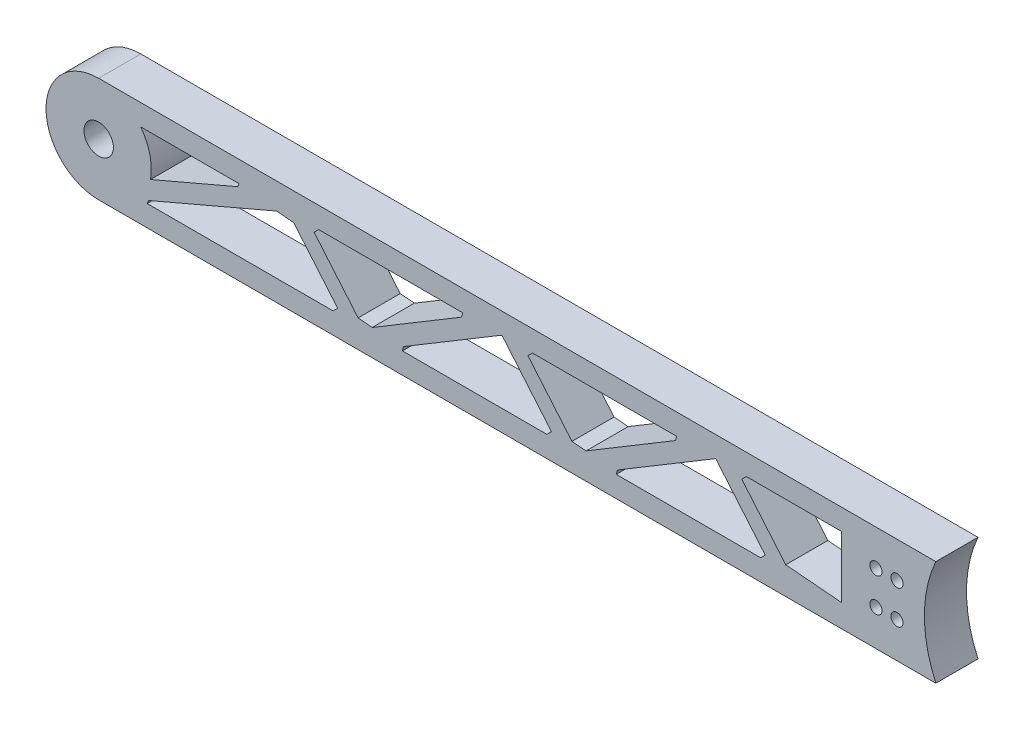
from build123d import *

# Parameters (mm, degrees)
EXTRUDE_1_DEPTH          = 10
CUT_EXTRUDE_1_DEPTH      = 252.652538235
CUT_EXTRUDE_1_DEPTH_BACK = 252.652538235
SKETCH_7_R               = 3.5
CUT_EXTRUDE_5_DEPTH      = 252.652538235
SKETCH_8_R               = 5
CUT_EXTRUDE_6_DEPTH      = 3
SKETCH_9_R               = 3
CUT_EXTRUDE_7_DEPTH      = 252.652538235
CUT_EXTRUDE_START        = -10
SKETCH_11_R              = 27
CUT_EXTRUDE_9_DEPTH      = 10
SKETCH_12_R              = 30
CUT_EXTRUDE_10_DEPTH     = 10
SKETCH_14_R              = 1.45
CUT_EXTRUDE_12_DEPTH     = 300
CHAMFER_1_SIZE           = 16.633608268
CHAMFER_1_SIZE_2         = 2
CHAMFER_1_SIZE_3         = 1.419352868
CHAMFER_1_SIZE_4         = 1.457737974
CHAMFER_1_SIZE_5         = 2.415237377
CHAMFER_1_SIZE_6         = 1.523154621
CHAMFER_1_SIZE_7         = 3.004873211
SKETCH_15_R              = 5.25
SKETCH_15_R_2            = 3.5
CUT_EXTRUDE_13_DEPTH     = 3


with BuildPart() as part:
    # 草图1 → 凸台-拉伸1 (new body)
    with BuildSketch(Plane.XY):
        with BuildLine():
            Line((0, 12.5), (199.067804112, 12.5))
            ThreePointArc((199.067804112, 12.5), (250, 0), (199.067804112, -12.5))
            Line((199.067804112, -12.5), (0, -12.5))
            ThreePointArc((0, -12.5), (-12.5, 0), (0, 12.5))
        make_face()
    extrude(amount=EXTRUDE_1_DEPTH)

    # 草图3 → 切除-拉伸1 (cut, two sides: drawn at the far end of the back side and taken through both)
    with BuildSketch(Plane.XY.offset(10).offset(-CUT_EXTRUDE_1_DEPTH_BACK)):
        Polygon((176.376805713, 7.5), (151.73545401, 7.5), (164.376805713, -7.5), (176.376805713, -7.5), align=None)
        Polygon((159.145761472, -7.5), (146.504409769, 7.5), (146.399203355, 7.5), (121.399203355, -7.5), align=None)
        Polygon((113.624600829, -7.5), (138.624600829, 7.5), (100.983249125, 7.5), align=None)
        Polygon((70.646998471, -7.5), (108.393556588, -7.5), (95.752204884, 7.5), (95.646998471, 7.5), align=None)
        Polygon((50.231044241, 7.5), (62.872395944, -7.5), (87.872395944, 7.5), align=None)
        Polygon((10, -7.5), (57.641351703, -7.5), (45, 7.5), align=None)
        with BuildLine():
            Line((34.845635859, 7.5), (10, 7.5))
            ThreePointArc((10, 7.5), (12.156331085, 2.910947362), (12.312475569, -2.157068696))
            Line((12.312475569, -2.157068696), (34.845635859, 7.5))
        make_face()
    extrude(amount=CUT_EXTRUDE_1_DEPTH + CUT_EXTRUDE_1_DEPTH_BACK, mode=Mode.SUBTRACT)

    # 草图7 → 切除-拉伸5 (cut, through all)
    with BuildSketch(Plane(origin=(0, 0, 0), x_dir=(-1, 0, 0), z_dir=(0, 0, -1))):
        Circle(SKETCH_7_R)
    extrude(amount=-CUT_EXTRUDE_5_DEPTH, mode=Mode.SUBTRACT)

    # 草图8 → 切除-拉伸6 (cut)
    with BuildSketch(Plane(origin=(0, 0, 0), x_dir=(-1, 0, 0), z_dir=(0, 0, -1))):
        with Locations((-223, 0)):
            Circle(SKETCH_8_R)
    extrude(amount=-CUT_EXTRUDE_6_DEPTH, mode=Mode.SUBTRACT)

    # 草图9 → 切除-拉伸7 (cut, through all)
    with BuildSketch(Plane(origin=(0, 0, 0), x_dir=(-1, 0, 0), z_dir=(0, 0, -1))):
        with Locations((-223, 0)):
            Circle(SKETCH_9_R)
    extrude(amount=-CUT_EXTRUDE_7_DEPTH, mode=Mode.SUBTRACT)

    # 草图11 → 切除-拉伸9 (cut)
    with BuildSketch(Plane.XY.offset(10).offset(CUT_EXTRUDE_START)):
        with Locations((223, 0)):
            Circle(SKETCH_11_R)
    extrude(amount=CUT_EXTRUDE_9_DEPTH, mode=Mode.SUBTRACT)

    # 草图12 → 切除-拉伸10 (cut)
    with BuildSketch(Plane.XY.offset(10)):
        with Locations((226, 0)):
            Circle(SKETCH_12_R)
    extrude(amount=-CUT_EXTRUDE_10_DEPTH, mode=Mode.SUBTRACT)

    # 草图14 → 切除-拉伸12 (cut)
    with BuildSketch(Plane.XY.offset(10)):
        with Locations((184.5, 4)):
            Circle(SKETCH_14_R)
        with Locations((189.5, 4)):
            Circle(SKETCH_14_R)
        with Locations((189.5, -4)):
            Circle(SKETCH_14_R)
        with Locations((184.5, -4)):
            Circle(SKETCH_14_R)
    extrude(amount=-CUT_EXTRUDE_12_DEPTH, mode=Mode.SUBTRACT)

    # 倒角1
    # the kernel refuses this chamfer: 16.633608268, 3.004873211, 2.415237377, 2, 1.523154621, 1.457737974, 1.419352868 mm, written as the material it adds along each edge
    with BuildSketch(Plane(origin=(164.376805713, -7.5, 0), x_dir=(0.9999946519205123, -0.0032704939035876055, 0), z_dir=(0, 0, 1))) as chamfer_1_piece_1:
        Polygon((CHAMFER_1_SIZE * 0.999994651904, CHAMFER_1_SIZE * 0.00327049390353), (-CHAMFER_1_SIZE_2 * 0.646924574173, CHAMFER_1_SIZE_2 * 0.762553995026), (0, 0), align=None)
    extrude(amount=10)
    with BuildSketch(Plane(origin=(151.73545401, 7.5, 0), x_dir=(0.9996219169112968, 0.027495876610586605, 0), z_dir=(0, 0, 1))) as chamfer_1_piece_2:
        Polygon((CHAMFER_1_SIZE_2 * 0.999621916911, -CHAMFER_1_SIZE_2 * 0.0274958766106), (CHAMFER_1_SIZE_3 * 0.623158385834, -CHAMFER_1_SIZE_3 * 0.782095662754), (0, 0), align=None)
    extrude(amount=10)
    with BuildSketch(Plane(origin=(159.145761472, -7.5, 10), x_dir=(-0.9996219169112968, -0.02749587661058747, 0), z_dir=(0, 0, -1))) as chamfer_1_piece_3:
        Polygon((CHAMFER_1_SIZE_2 * 0.999621916911, CHAMFER_1_SIZE_2 * 0.0274958766106), (CHAMFER_1_SIZE_3 * 0.623158385834, CHAMFER_1_SIZE_3 * 0.782095662754), (0, 0), align=None)
    extrude(amount=10)
    with BuildSketch(Plane(origin=(121.399203355, -7.5, 10), x_dir=(0.9985473741645164, -0.05388080872768336, 0), z_dir=(0, 0, -1))) as chamfer_1_piece_4:
        Polygon((CHAMFER_1_SIZE_4 * 0.998547373967, -CHAMFER_1_SIZE_4 * 0.053880808717), (CHAMFER_1_SIZE_2 * 0.828525861946, -CHAMFER_1_SIZE_2 * 0.559950797917), (0, 0), align=None)
    extrude(amount=10)
    with BuildSketch(Plane(origin=(113.624600829, -7.5, 10), x_dir=(-0.6693179531686358, 0.7429760948820275, 0), z_dir=(0, 0, -1))) as chamfer_1_piece_5:
        Polygon((CHAMFER_1_SIZE_2 * 0.999455005814, CHAMFER_1_SIZE_2 * 0.033010473375), (-CHAMFER_1_SIZE_5 * 0.191677362679, CHAMFER_1_SIZE_5 * 0.981457991195), (0, 0), align=None)
    extrude(amount=10)
    with BuildSketch(Plane(origin=(138.624600829, 7.5, 0), x_dir=(-0.9985473741645164, 0.05388080872768389, 0), z_dir=(0, 0, 1))) as chamfer_1_piece_6:
        Polygon((CHAMFER_1_SIZE_4 * 0.998547373967, CHAMFER_1_SIZE_4 * 0.053880808717), (CHAMFER_1_SIZE_2 * 0.828525861946, CHAMFER_1_SIZE_2 * 0.559950797917), (0, 0), align=None)
    extrude(amount=10)
    with BuildSketch(Plane(origin=(100.983249125, 7.5, 10), x_dir=(0.6007510451121151, -0.7994361649291964, 0), z_dir=(0, 0, -1))) as chamfer_1_piece_7:
        Polygon((CHAMFER_1_SIZE_3 * 0.998441703797, -CHAMFER_1_SIZE_3 * 0.0558046920381), (CHAMFER_1_SIZE_2 * 0.600751045112, -CHAMFER_1_SIZE_2 * 0.799436164929), (0, 0), align=None)
    extrude(amount=10)
    with BuildSketch(Plane(origin=(70.646998471, -7.5, 0), x_dir=(0.8430222103307435, 0.537878752963033, 0), z_dir=(0, 0, 1))) as chamfer_1_piece_8:
        Polygon((CHAMFER_1_SIZE_2 * 0.999621916911, -CHAMFER_1_SIZE_2 * 0.0274958766106), (CHAMFER_1_SIZE_4 * 0.843022210164, -CHAMFER_1_SIZE_4 * 0.537878752857), (0, 0), align=None)
    extrude(amount=10)
    with BuildSketch(Plane(origin=(108.393556588, -7.5, 0), x_dir=(-0.6007510451121131, 0.799436164929198, 0), z_dir=(0, 0, 1)), Plane(origin=(50.231044241, 7.5, 0), x_dir=(0.6007510451121165, -0.7994361649291954, 0), z_dir=(0, 0, 1)), Plane(origin=(57.641351703, -7.5, 0), x_dir=(-0.6007510451121163, 0.7994361649291957, 0), z_dir=(0, 0, 1))) as chamfer_1_piece_9:
        Polygon((CHAMFER_1_SIZE_3 * 0.998441703797, CHAMFER_1_SIZE_3 * 0.0558046920381), (CHAMFER_1_SIZE_2 * 0.600751045112, CHAMFER_1_SIZE_2 * 0.799436164929), (0, 0), align=None)
    extrude(amount=10)
    with BuildSketch(Plane(origin=(87.872395944, 7.5, 10), x_dir=(-0.8430222103307434, -0.5378787529630333, 0), z_dir=(0, 0, -1))) as chamfer_1_piece_10:
        Polygon((CHAMFER_1_SIZE_2 * 0.999621916911, CHAMFER_1_SIZE_2 * 0.0274958766106), (CHAMFER_1_SIZE_4 * 0.843022210164, CHAMFER_1_SIZE_4 * 0.537878752857), (0, 0), align=None)
    extrude(amount=10)
    with BuildSketch(Plane(origin=(62.872395944, -7.5, 10), x_dir=(0.8689411613860879, 0.4949154049420938, 0), z_dir=(0, 0, -1))) as chamfer_1_piece_11:
        Polygon((CHAMFER_1_SIZE_5 * 0.99974277381, -CHAMFER_1_SIZE_5 * 0.0226800806836), (-CHAMFER_1_SIZE_2 * 0.18152448307, -CHAMFER_1_SIZE_2 * 0.983386425596), (0, 0), align=None)
    extrude(amount=10)
    with BuildSketch(Plane(origin=(10, -7.5, 10), x_dir=(0.9079663603978809, 0.419043062686671, 0), z_dir=(0, 0, -1))) as chamfer_1_piece_12:
        Polygon((CHAMFER_1_SIZE_2 * 0.999621916911, CHAMFER_1_SIZE_2 * 0.0274958766106), (CHAMFER_1_SIZE_6 * 0.907966360501, CHAMFER_1_SIZE_6 * 0.419043062734), (0, 0), align=None)
    extrude(amount=10)
    with BuildSketch(Plane(origin=(45, 7.5, 10), x_dir=(-0.9261548899255846, -0.3771433677886015, 0), z_dir=(0, 0, -1))) as chamfer_1_piece_13:
        Polygon((CHAMFER_1_SIZE_7 * 0.999834715095, -CHAMFER_1_SIZE_7 * 0.0181808325096), (-CHAMFER_1_SIZE_2 * 0.308450800004, -CHAMFER_1_SIZE_2 * 0.951240297705), (0, 0), align=None)
    extrude(amount=10)
    with BuildSketch(Plane(origin=(34.845635859, 7.5, 0), x_dir=(-0.9987654472434115, 0.0496747560906775, 0), z_dir=(0, 0, 1))) as chamfer_1_piece_14:
        Polygon((CHAMFER_1_SIZE_6 * 0.998765447357, CHAMFER_1_SIZE_6 * 0.0496747560963), (CHAMFER_1_SIZE_2 * 0.898442451911, CHAMFER_1_SIZE_2 * 0.439091289601), (0, 0), align=None)
    extrude(amount=10)

    # 草图15 → 切除-拉伸13 (cut)
    with BuildSketch(Plane(origin=(0, 0, 0), x_dir=(-1, 0, 0), z_dir=(0, 0, -1))):
        Circle(SKETCH_15_R)
        Circle(SKETCH_15_R_2, mode=Mode.SUBTRACT)
    extrude(amount=-CUT_EXTRUDE_13_DEPTH, mode=Mode.SUBTRACT)


solid = part.part
